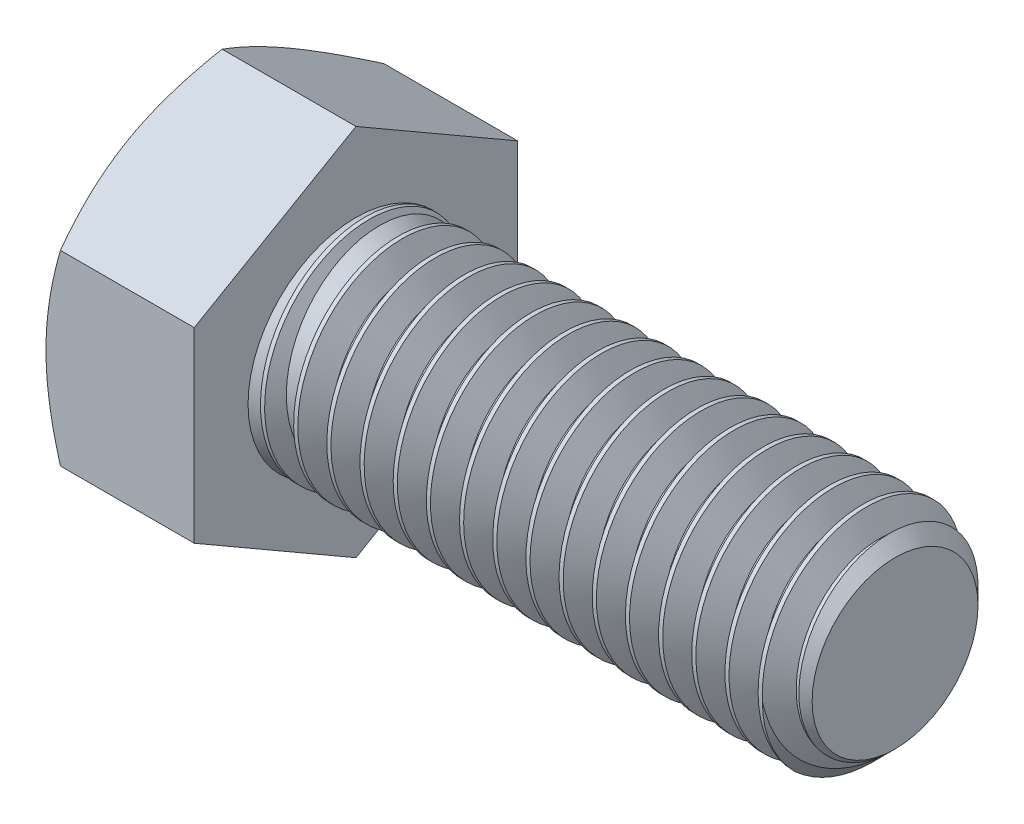
from build123d import *

# Parameters (mm, degrees)
SKETCH5_R           = 6.35
BOSS_EXTRUDE3_DEPTH = 31.75
CHAMFER1_SIZE       = 1.465384615
BOSS_EXTRUDE4_DEPTH = 8.73125
SKETCH8_OUTSIDE_W   = 183.498
SKETCH8_OUTSIDE_H   = 186.446
SKETCH8_OUTSIDE_R   = 9.525
CUT_EXTRUDE3_DEPTH  = 44.016563398
CUT_EXTRUDE3_DRAFT  = -60
CUT_EXTRUDE4_DEPTH  = 0.254
CIRPATTERN1_COUNT   = 6
CUT_SWEEP1_PITCH    = 1.953846154


with BuildPart() as part:
    # Sketch5 → Boss-Extrude3 (new body)
    with BuildSketch(Plane(origin=(20.240625, 0, 0), x_dir=(0, 0, -1), z_dir=(1, 0, 0))):
        Circle(SKETCH5_R)
    extrude(amount=-BOSS_EXTRUDE3_DEPTH)

    # Chamfer1
    chamfer1_edges = [part.edges().sort_by_distance(p)[0] for p in [
        (20.240625, 0, 6.35),
    ]]
    chamfer(chamfer1_edges, length=CHAMFER1_SIZE)

    # Cut-Sweep1: the profile of Sketch10 profile screwed along a right-hand helix of 17.25 turns, 10 arcs to a turn; built about Z, then put on its axis
    cut_sweep1_z = Axis((0, 0, 0), (0, 0, 1))
    cut_sweep1_corners = [(6.3503, 0, 0.000173205), (5.080939697, 0, -0.732692308), (5.080939697, 0, -0.976923077), (6.3503, 0, -1.70978859)]
    with BuildLine(mode=Mode.PRIVATE) as cut_sweep1_profile:
        Line(cut_sweep1_corners[0], cut_sweep1_corners[1])
        Line(cut_sweep1_corners[1], cut_sweep1_corners[2])
        Line(cut_sweep1_corners[2], cut_sweep1_corners[3])
        Line(cut_sweep1_corners[3], cut_sweep1_corners[0])
    cut_sweep1_cap = Face(cut_sweep1_profile.wire())
    cut_sweep1_turn_angles = [0, 18, 36, 54, 72, 90, 108, 126, 144, 162, 180, 198, 216, 234, 252, 270, 288, 306, 324, 342, 360]
    cut_sweep1_turn_weights = [1, 0.9510565162951535, 1, 0.9510565162951535, 1, 0.9510565162951535, 1, 0.9510565162951535, 1, 0.9510565162951535, 1, 0.9510565162951535, 1, 0.9510565162951535, 1, 0.9510565162951535, 1, 0.9510565162951535, 1, 0.9510565162951535, 1]
    cut_sweep1_turn_rails = [Edge.make_bspline([Vector(p[0], p[1], 0).rotate(cut_sweep1_z, cut_sweep1_turn_angles[k]) / cut_sweep1_turn_weights[k] + Vector(0, 0, p[2] + CUT_SWEEP1_PITCH * cut_sweep1_turn_angles[k] / 360) for k in range(21)], [0, 0, 0, 1, 1, 2, 2, 3, 3, 4, 4, 5, 5, 6, 6, 7, 7, 8, 8, 9, 9, 10, 10, 10], 2, cut_sweep1_turn_weights) for p in cut_sweep1_corners]
    cut_sweep1_turn_sides = [Face.make_surface_from_curves(cut_sweep1_turn_rails[p[0]], cut_sweep1_turn_rails[p[1]]) for p in [(0, 1), (1, 2), (2, 3), (3, 0)]]
    cut_sweep1_last_angles = [6120, 6138, 6156, 6174, 6192, 6201, 6210]
    cut_sweep1_last_weights = [1, 0.9510565162951535, 1, 0.9510565162951535, 1, 0.9876883405951625, 1]
    cut_sweep1_last_rails = [Edge.make_bspline([Vector(p[0], p[1], 0).rotate(cut_sweep1_z, cut_sweep1_last_angles[k]) / cut_sweep1_last_weights[k] + Vector(0, 0, p[2] + CUT_SWEEP1_PITCH * cut_sweep1_last_angles[k] / 360) for k in range(7)], [0, 0, 0, 1, 1, 2, 2, 3, 3, 3], 2, cut_sweep1_last_weights) for p in cut_sweep1_corners]
    cut_sweep1_last_sides = [Face.make_surface_from_curves(cut_sweep1_last_rails[p[0]], cut_sweep1_last_rails[p[1]]) for p in [(0, 1), (1, 2), (2, 3), (3, 0)]]
    cut_sweep1 = Plane(origin=(20.240625, 0, 0), x_dir=(0, 1, 0), z_dir=(-1, 0, 0)) * Solid(Shell([*[p.moved(Location((0, 0, CUT_SWEEP1_PITCH * i))) for i in range(17) for p in cut_sweep1_turn_sides], *cut_sweep1_last_sides, cut_sweep1_cap, cut_sweep1_cap.rotate(cut_sweep1_z, 6210).moved(Location((0, 0, CUT_SWEEP1_PITCH * 6210 / 360)))]))
    add(cut_sweep1, mode=Mode.SUBTRACT)



with BuildPart() as body_2:
    # Sketch6 → Boss-Extrude4 (new body)
    with BuildSketch(Plane.ZY.offset(11.509375)):
        Polygon((9.525, 5.499261314), (0, 10.998522628), (-9.525, 5.499261314), (-9.525, -5.499261314), (0, -10.998522628), (9.525, -5.499261314), align=None)
    extrude(amount=BOSS_EXTRUDE4_DEPTH)


with BuildPart() as cut_extrude3_tool:
    # Sketch8 outside → Cut-Extrude3 (with draft: the straight prism first)
    with BuildSketch(Plane.ZY.offset(20.240625)):
        Rectangle(SKETCH8_OUTSIDE_W, SKETCH8_OUTSIDE_H)
        Circle(SKETCH8_OUTSIDE_R, mode=Mode.SUBTRACT)
    extrude(amount=-CUT_EXTRUDE3_DEPTH)
    # Cut-Extrude3: the draft: its side faces are tilted about the plane it starts from
    cut_extrude3_sides = [cut_extrude3_tool.faces().sort_by_distance(p)[0] for p in [
        (1.767656699, -93.223, 0),
        (1.767656699, 0, 91.749),
        (1.767656699, 93.223, 0),
        (1.767656699, 0, -91.749),
        (1.767656699, 0, -9.525),
    ]]
    draft(cut_extrude3_sides, Plane.ZY.offset(20.240625), CUT_EXTRUDE3_DRAFT)


with BuildPart() as body_2_1:
    add(body_2.part)

    # Cut-Extrude3: cut by cut_extrude3_tool
    add(cut_extrude3_tool.part, mode=Mode.SUBTRACT)

    # Sketch12 → Cut-Extrude4 (cut)
    with BuildSketch(Plane.ZY.offset(20.240625)):
        with BuildLine():
            Line((0.28575, 7.33425), (0.28575, 4.09575))
            ThreePointArc((0.28575, 4.09575), (0, 3.81), (-0.28575, 4.09575))
            Line((-0.28575, 4.09575), (-0.28575, 7.33425))
            ThreePointArc((-0.28575, 7.33425), (0, 7.62), (0.28575, 7.33425))
        make_face()
    cut_extrude4 = extrude(amount=-CUT_EXTRUDE4_DEPTH, mode=Mode.SUBTRACT)

    # CirPattern1: Cut-Extrude4 ×6 about axis
    cirpattern1_axis = Axis((0, 0, 0), (1, 0, 0))
    for i in range(1, CIRPATTERN1_COUNT):
        add(cut_extrude4.rotate(cirpattern1_axis, i * 360 / CIRPATTERN1_COUNT), mode=Mode.SUBTRACT)


with BuildPart() as part_1:
    add(part.part)

    add(body_2_1.part)  # Revolve7 merges body 2
    # Sketch13 → Revolve7 (revolve)
    with BuildSketch(Plane.XY, mode=Mode.PRIVATE) as revolve7_sk:
        Polygon((-11.763375, 0), (-0.50007382, 0), (-11.509375, 6.356223), (-11.763375, 6.356223), align=None)
    revolve(revolve7_sk.sketch.rotate(Axis((-11.763375, 0, 0), (1, 0, 0)), 180), axis=Axis((-11.763375, 0, 0), (1, 0, 0)))


solid = part_1.part
